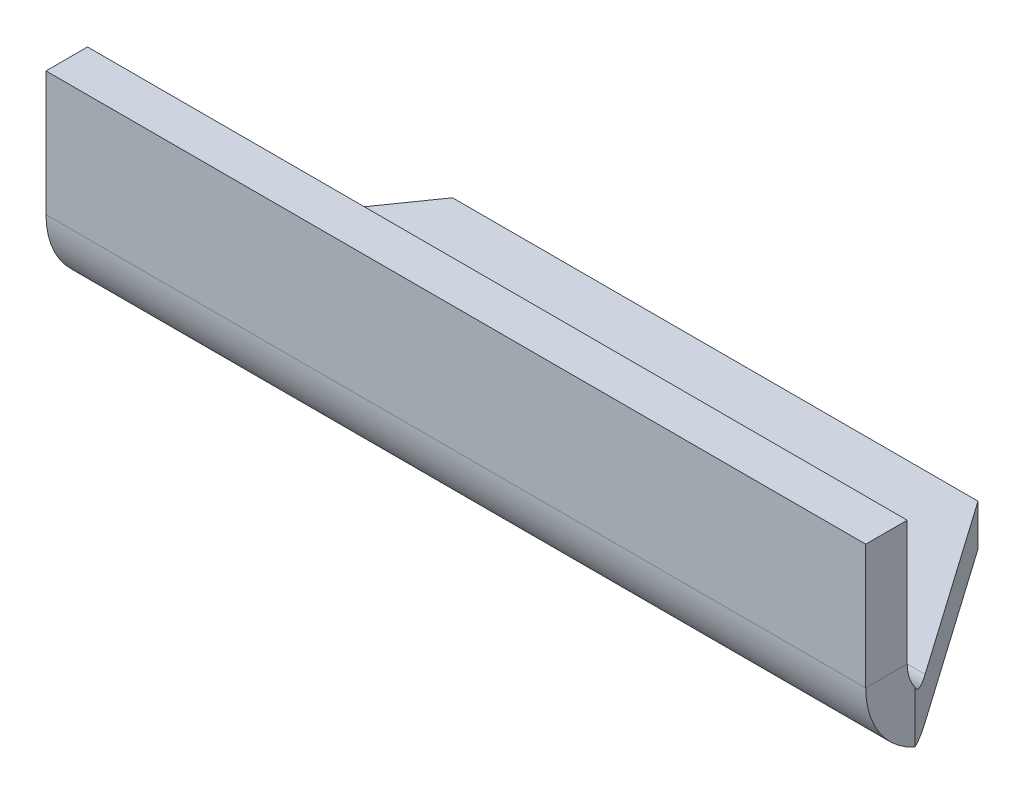
from build123d import *

# Parameters (mm, degrees)
SKETCH1_W                    = 158
SKETCH1_H                    = 50
BASE_FLANGE1_DEPTH           = 8
EDGE_FLANGE1_STRIP_W         = 48
EDGE_FLANGE1_STRIP_H         = 8
EDGE_FLANGE1_STRIP_CUT_DEPTH = 158
EDGE_FLANGE1_DEPTH           = 158
CHAMFER1_SIZE                = 40.5
CHAMFER1_SIZE2               = 28.358405297
MIRROR2_START                = 55.822576735
MIRROR2_OUTLINE_W            = 53
MIRROR2_OUTLINE_H            = 13
MIRROR2_DEPTH                = 23.229845673


# Read off the part's stored shape, not the designer's step: Mirror2
# Sheet-metal steps are written as plain solids
with BuildPart() as part:
    # Sketch1 → Base-Flange1 (new body)
    with BuildSketch(Plane(origin=(0, 0, 0), x_dir=(1, 0, 0), z_dir=(0, 1, 0))):
        Rectangle(SKETCH1_W, SKETCH1_H)
    extrude(amount=-BASE_FLANGE1_DEPTH)

    # Edge-Flange1 strip (across the edge) → Edge-Flange1 strip cut (cut)
    with BuildSketch(Plane(origin=(-79, 0, 25), x_dir=(0, 0, -1), z_dir=(1, 0, 0))):
        with Locations((-8, -4)):
            Rectangle(EDGE_FLANGE1_STRIP_W, EDGE_FLANGE1_STRIP_H)
    extrude(amount=EDGE_FLANGE1_STRIP_CUT_DEPTH, mode=Mode.SUBTRACT)

    # Edge-Flange1 section (across the edge) → Edge-Flange1 (add)
    with BuildSketch(Plane(origin=(-79, 0, 25), x_dir=(0, 0, -1), z_dir=(1, 0, 0))):
        with BuildLine():
            Line((0, 8), (0, 32))
            Line((0, 32), (8, 32))
            Line((8, 32), (8, 8))
            ThreePointArc((8, 8), (10.343145751, 2.343145751), (16, 0))
            Line((16, 0), (16, -8))
            ThreePointArc((16, -8), (4.686291501, -3.313708499), (0, 8))
        make_face()
    extrude(amount=EDGE_FLANGE1_DEPTH)

    # Chamfer1
    chamfer1_edges = [part.edges().sort_by_distance(p)[0] for p in [
        (-79, -4, -25),
    ]]
    chamfer1_side = [part.faces().sort_by_distance(p)[0] for p in [
        (-79, -0.640312424, -8),
    ]]
    chamfer(chamfer1_edges, length=CHAMFER1_SIZE, length2=CHAMFER1_SIZE2, reference=chamfer1_side[0])

    # Mirror2 outline → Mirror2 (cut)
    with BuildSketch(Plane(origin=(0, 0, 0), x_dir=(0.5735764363510512, 0, 0.8191520442889882), z_dir=(0.8191520442889882, 0, -0.5735764363510512)).offset(MIRROR2_START)):
        with Locations((33.5, 1.5)):
            Rectangle(MIRROR2_OUTLINE_W, MIRROR2_OUTLINE_H)
    extrude(amount=MIRROR2_DEPTH, mode=Mode.SUBTRACT)


solid = part.part
